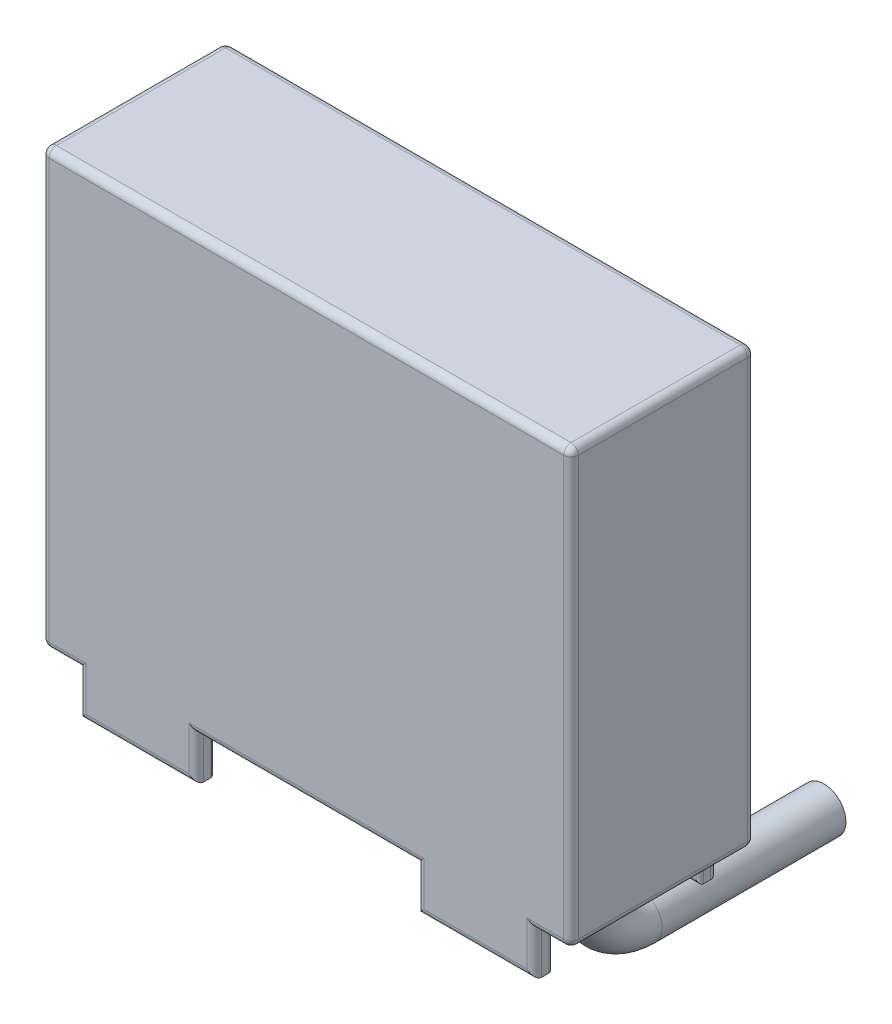
from build123d import *

# Parameters (mm, degrees)
SKETCH1_W           = 7.2
SKETCH1_H           = 6.5
BOSS_EXTRUDE1_DEPTH = 2.5
SKETCH5_W           = 6.7
SKETCH5_H           = 2
CUT_EXTRUDE1_DEPTH  = 0.7
SKETCH6_W           = 3
SKETCH6_H           = 0.6
SKETCH6_W_2         = 0.5
CUT_EXTRUDE2_DEPTH  = 3
SKETCH4_R           = 0.3
FILLET1_R           = 0.1
FILLET2_R           = 0.05


with BuildPart() as part:
    # Sketch1 → Boss-Extrude1 (new body)
    with BuildSketch(Plane.XY):
        with Locations((0, 3.75)):
            Rectangle(SKETCH1_W, SKETCH1_H)
    extrude(amount=BOSS_EXTRUDE1_DEPTH)

    # Sketch5 → Cut-Extrude1 (cut)
    with BuildSketch(Plane(origin=(0, 0.5, 0), x_dir=(-1, 0, 0), z_dir=(0, -1, 0))):
        with Locations((0, -1.25)):
            Rectangle(SKETCH5_W, SKETCH5_H)
    extrude(amount=-CUT_EXTRUDE1_DEPTH, mode=Mode.SUBTRACT)

    # Sketch6 → Cut-Extrude2 (cut)
    with BuildSketch(Plane.XY.offset(2.5)):
        with Locations((0, 0.8)):
            Rectangle(SKETCH6_W, SKETCH6_H)
        with Locations((-3.35, 0.8)):
            Rectangle(SKETCH6_W_2, SKETCH6_H)
        with Locations((3.35, 0.8)):
            Rectangle(SKETCH6_W_2, SKETCH6_H)
    extrude(amount=-CUT_EXTRUDE2_DEPTH, mode=Mode.SUBTRACT)

    # Pin: sweep along a path in Sketch7
    with BuildLine(Plane(origin=(-2.54, 0, 0), x_dir=(0, 0, -1), z_dir=(1, 0, 0))) as pin_path:
        Line((-1.25, 1.2), (-1.25, 0.75))
        ThreePointArc((-1.25, 0.75), (-1.030330086, 0.219669914), (-0.5, 0))
        Line((-0.5, 0), (2, 0))
    # Sketch4 → Pin (sweep)
    with BuildSketch(Plane.XZ.offset(-1.2)):
        with Locations((-2.54, 1.25)):
            Circle(SKETCH4_R)
        with Locations((2.54, 1.25)):
            Circle(SKETCH4_R)
    sweep(path=pin_path.line)

    # Fillet1
    fillet1_edges = [part.edges().sort_by_distance(p)[0] for p in [
        (-3.6, 4.05, 2.5),
        (3.6, 4.05, 0),
        (-2.3, 0.5, 0),
        (2.3, 0.5, 0),
        (3.6, 4.05, 2.5),
        (-2.3, 0.5, 2.5),
        (2.3, 0.5, 2.5),
        (-3.6, 4.05, 0),
        (3.6, 1.1, 1.25),
        (3.1, 0.8, 0),
        (3.35, 1.1, 0),
        (0, 7, 0),
        (3.35, 1.1, 2.5),
        (3.1, 0.8, 2.5),
        (-3.35, 1.1, 0),
        (-3.6, 1.1, 1.25),
        (-3.1, 0.8, 0),
        (-3.1, 0.8, 2.5),
        (-3.35, 1.1, 2.5),
        (0, 7, 2.5),
        (-1.5, 0.8, 0),
        (0, 1.1, 0),
        (-3.6, 7, 1.25),
        (1.5, 0.8, 0),
        (3.6, 7, 1.25),
        (-1.5, 0.8, 2.5),
        (1.5, 0.8, 2.5),
        (0, 1.1, 2.5),
    ]]
    fillet(fillet1_edges, radius=FILLET1_R)

    # Fillet2
    fillet2_edges = [part.edges().sort_by_distance(p)[0] for p in [
        (-2.84, 1.2, 1.25),
        (2.24, 1.2, 1.25),
        (3.35, 1.2, 1.25),
        (3.35, 1.15, 2.25),
        (0, 1.2, 0.25),
        (3.35, 1.15, 0.25),
        (-3.35, 1.2, 1.25),
        (-3.35, 1.15, 0.25),
        (0, 1.2, 2.25),
        (-3.35, 1.15, 2.25),
        (2.3, 0.5, 2.25),
        (-2.3, 0.5, 2.25),
        (1.5, 0.8, 2.25),
        (0, 1.1, 2.25),
        (-1.5, 0.8, 2.25),
        (-3.1, 0.8, 2.25),
        (-3.225, 1.1, 2.25),
        (3.225, 1.1, 2.25),
        (3.1, 0.8, 2.25),
        (-2.3, 0.5, 0.25),
        (2.3, 0.5, 0.25),
        (3.1, 0.8, 0.25),
        (3.225, 1.1, 0.25),
        (3.35, 1.1, 1.25),
        (-3.35, 1.1, 1.25),
        (-3.225, 1.1, 0.25),
        (-3.1, 0.8, 0.25),
        (-1.5, 0.8, 0.25),
        (0, 1.1, 0.25),
        (1.5, 0.8, 0.25),
    ]]
    fillet(fillet2_edges, radius=FILLET2_R - 0.0001)  # a hair under: the kernel refuses the full size


solid = part.part
